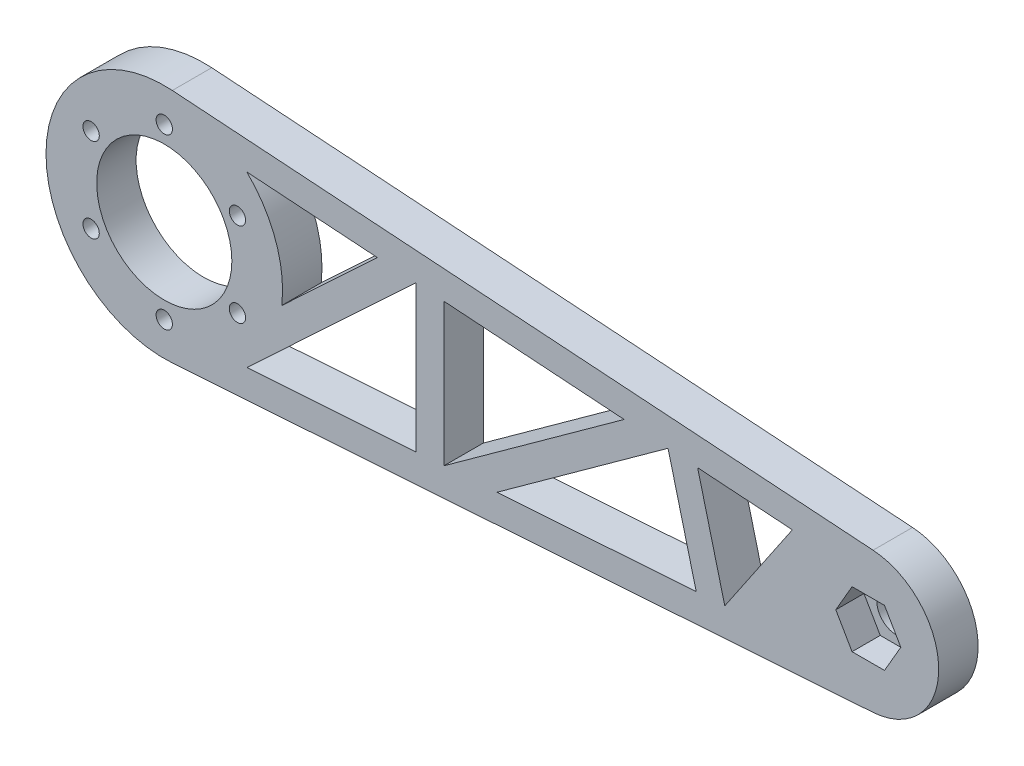
from build123d import *

# Parameters (mm, degrees)
EXTRUDE_1_DEPTH          = 7
CUT_EXTRUDE_1_DEPTH      = 140.270420406
CUT_EXTRUDE_1_DEPTH_BACK = 140.270420406
CUT_EXTRUDE_2_DEPTH      = 5
SKETCH_12_R              = 1.45
CUT_EXTRUDE_3_DEPTH      = 140.270420406
SKETCH_14_R              = 12
CUT_EXTRUDE_4_DEPTH      = 140.270420406
SKETCH_15_R              = 3.5
CUT_EXTRUDE_5_DEPTH      = 10
SKETCH_16_R              = 2.8
CUT_EXTRUDE_6_DEPTH      = 3
PATTERN_CIRCULAR_1_COUNT = 6


with BuildPart() as part:
    # 草图2 → 凸台-拉伸1 (new body)
    with BuildSketch(Plane.XY):
        with BuildLine():
            Line((1.428, 20.951391744), (125.85, 12.471066514))
            ThreePointArc((125.85, 12.471066514), (137.5, 0), (125.85, -12.471066514))
            Line((125.85, -12.471066514), (1.428, -20.951391744))
            ThreePointArc((1.428, -20.951391744), (-21, 0), (1.428, 20.951391744))
        make_face()
    extrude(amount=EXTRUDE_1_DEPTH)

    # 草图3 → 切除-拉伸1 (cut, two sides: drawn at the far end of the back side and taken through both)
    with BuildSketch(Plane.XY.offset(7).offset(-CUT_EXTRUDE_1_DEPTH_BACK)):
        with BuildLine():
            ThreePointArc((14.657987472, 15.038065143), (19.784577979, 7.04063024), (20.86269223, -2.397513905))
            Line((20.86269223, -2.397513905), (37.832309087, 13.458555215))
            Line((37.832309087, 13.458555215), (14.657987472, 15.038065143))
        make_face()
        Polygon((44.657987472, 12.993332243), (14.657987472, -15.038065143), (44.657987472, -12.993332243), align=None)
        Polygon((49.646414078, 12.653332243), (49.646414078, -12.653332243), (81.646414078, 10.472283817), align=None)
        Polygon((89.447040438, 9.940610571), (59.071666369, -12.010928128), (94.447040438, -9.599821755), align=None)
        Polygon((111.519663952, 8.436189922), (94.699739521, 9.58259835), (99.519663952, -9.254083082), align=None)
    extrude(amount=CUT_EXTRUDE_1_DEPTH + CUT_EXTRUDE_1_DEPTH_BACK, mode=Mode.SUBTRACT)

    # 草图7 → 切除-拉伸2 (cut)
    with BuildSketch(Plane.XY.offset(7)):
        Polygon((127.879739572, 5), (122.120260428, 5), (119.23, 0), (122.120260428, -5), (127.879739572, -5), (130.77, 0), align=None)
    extrude(amount=-CUT_EXTRUDE_2_DEPTH, mode=Mode.SUBTRACT)

    # 草图12 → 切除-拉伸3 (cut, through all)
    with BuildSketch(Plane.XY.offset(7)):
        with Locations((0, 15)):
            Circle(SKETCH_12_R)
        with Locations((12.990381057, 7.5)):
            Circle(SKETCH_12_R)
        with Locations((12.990381057, -7.5)):
            Circle(SKETCH_12_R)
        with Locations((0, -15)):
            Circle(SKETCH_12_R)
        with Locations((-12.990381057, -7.5)):
            Circle(SKETCH_12_R)
        with Locations((-12.990381057, 7.5)):
            Circle(SKETCH_12_R)
    extrude(amount=-CUT_EXTRUDE_3_DEPTH, mode=Mode.SUBTRACT)

    # 草图14 → 切除-拉伸4 (cut, through all)
    with BuildSketch(Plane.XY.offset(7)):
        Circle(SKETCH_14_R)
    extrude(amount=-CUT_EXTRUDE_4_DEPTH, mode=Mode.SUBTRACT)

    # 草图15 → 切除-拉伸5 (cut)
    with BuildSketch(Plane(origin=(0, 0, 0), x_dir=(-1, 0, 0), z_dir=(0, 0, -1))):
        with Locations((-125, 0)):
            Circle(SKETCH_15_R)
    extrude(amount=-CUT_EXTRUDE_5_DEPTH, mode=Mode.SUBTRACT)

    # 草图16 → 切除-拉伸6 (cut)
    with BuildSketch(Plane(origin=(0, 0, 0), x_dir=(-1, 0, 0), z_dir=(0, 0, -1))):
        with Locations((0, 15)):
            Circle(SKETCH_16_R)
    cut_extrude_6 = extrude(amount=-CUT_EXTRUDE_6_DEPTH, mode=Mode.SUBTRACT)

    # 阵列(圆周)1: 切除-拉伸6 ×6 about axis
    pattern_circular_1_axis = Axis((0, 0, 0), (0, 0, 1))
    for i in range(1, PATTERN_CIRCULAR_1_COUNT):
        add(cut_extrude_6.rotate(pattern_circular_1_axis, i * 360 / PATTERN_CIRCULAR_1_COUNT), mode=Mode.SUBTRACT)


solid = part.part
